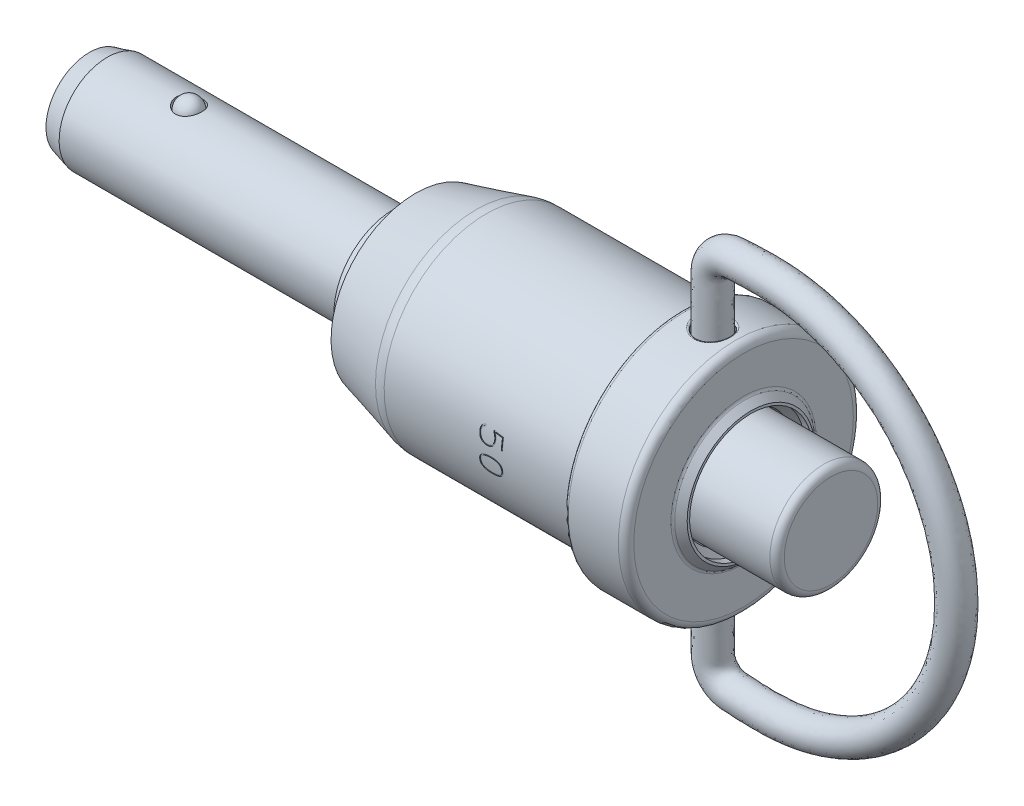
from build123d import *

# Parameters (mm, degrees)
CUT_REVOLVE_THIN1_START         = -29.083
CUT_REVOLVE_THIN1_OUTLINE_R     = 2.0828
CUT_REVOLVE_THIN1_DEPTH         = 48.895
CUT_REVOLVE_THIN1_START_2       = 3.3655
CUT_REVOLVE_THIN1_2_OUTLINE_R   = 3.556
CUT_REVOLVE_THIN1_2_OUTLINE_R_2 = 2.0828
CUT_REVOLVE_THIN1_2_DEPTH       = 16.4465
CUT_REVOLVE_THIN1_3_OUTLINE_R   = 2.159
CUT_REVOLVE_THIN1_3_DEPTH       = 48.895
CUT_REVOLVE_THIN1_START_3       = 3.2893
CUT_REVOLVE_THIN1_4_OUTLINE_R   = 3.6322
CUT_REVOLVE_THIN1_4_OUTLINE_R_2 = 2.159
CUT_REVOLVE_THIN1_4_DEPTH       = 16.5227
CHAMFER1_SIZE                   = 0.4064
FILLET1_R                       = 0.254
SKETCH7_W                       = 1.0795
SKETCH7_H                       = 2.0955
FILLET2_R                       = 0.127
FILLET2_OF_MIRROR3_R            = 0.127
SKETCH10_R                      = 1.016
FILLET3_R                       = 0.508
FILLET4_R                       = 0.47625
CUT_EXTRUDE1_START              = -6.57225
CUT_EXTRUDE1_OUTLINE_R          = 2.0828
CUT_EXTRUDE1_DEPTH              = 6.57225
FILLET5_R                       = 2.54
SKETCH13_W                      = 1.44145
SKETCH13_H                      = 2.794
FILLET6_R                       = 0.254
CUT_EXTRUDE2_REACH              = 37.166
CUT_EXTRUDE2_END_RADIUS         = 6.731


with BuildPart() as part:
    # Sketch2 → Revolve1 (revolve)
    with BuildSketch(Plane.XY):
        Polygon((14.0462, 3.556), (19.812, 3.556), (19.812, 0), (-29.083, 0), (-29.083, 2.8575), (-27.898073869, 3.175), (-9.017, 3.175), (-9.017, 5.186058546), (-3.2512, 6.731), (9.9822, 6.731), (9.9822, 7.747), (10.9982, 7.747), (13.0302, 7.747), (14.0462, 7.747), align=None)
    revolve(axis=Axis((29.083, 0, 0), (-1, 0, 0)))

    # Cut-Revolve-Thin1 3 outline → Cut-Revolve-Thin1 3 (cut)
    with BuildSketch(Plane.YZ.offset(CUT_REVOLVE_THIN1_START)):
        Circle(CUT_REVOLVE_THIN1_3_OUTLINE_R)
    extrude(amount=CUT_REVOLVE_THIN1_3_DEPTH, mode=Mode.SUBTRACT)

    # Cut-Revolve-Thin1 4 outline → Cut-Revolve-Thin1 4 (cut)
    with BuildSketch(Plane.YZ.offset(CUT_REVOLVE_THIN1_START_3)):
        Circle(CUT_REVOLVE_THIN1_4_OUTLINE_R)
        Circle(CUT_REVOLVE_THIN1_4_OUTLINE_R_2, mode=Mode.SUBTRACT)
    extrude(amount=CUT_REVOLVE_THIN1_4_DEPTH, mode=Mode.SUBTRACT)

    # Chamfer1
    chamfer1_edges = [part.edges().sort_by_distance(p)[0] for p in [
        (14.0462, -3.6322, 0),
    ]]
    chamfer(chamfer1_edges, length=CHAMFER1_SIZE)

    # Sketch4 → Revolve2 (revolve)
    with BuildSketch(Plane.XY):
        Polygon((14.0462, 4.0386), (14.5288, 4.0386), (14.5288, 4.199466667), (14.0462, 4.682066667), align=None)
    revolve(axis=Axis((29.083, 0, 0), (-1, 0, 0)))

    # Fillet1
    fillet1_edges = [part.edges().sort_by_distance(p)[0] for p in [
        (14.0462, -4.682066667, 0),
    ]]
    fillet(fillet1_edges, radius=FILLET1_R)

    # Sketch5 → Cut-Revolve1 (revolve, cut)
    with BuildSketch(Plane.XY):
        with BuildLine():
            Line((-23.4061, 2.87655), (-21.6154, 2.87655))
            ThreePointArc((-21.6154, 2.87655), (-22.51075, 3.7719), (-23.4061, 2.87655))
        make_face()
    cut_revolve1 = revolve(axis=Axis((-23.4061, 2.87655, 0), (1, 0, 0)), mode=Mode.SUBTRACT)

    # Mirror1: Cut-Revolve1 across plane
    add(cut_revolve1.mirror(Plane.ZX), mode=Mode.SUBTRACT)

    # Sketch7 → Cut-Revolve2 (revolve, cut)
    with BuildSketch(Plane.XY, mode=Mode.PRIVATE) as cut_revolve2_sk:
        with Locations((11.47445, 6.69925)):
            Rectangle(SKETCH7_W, SKETCH7_H)
    cut_revolve2 = revolve(cut_revolve2_sk.sketch.rotate(Axis((12.0142, 5.6515, 0), (0, -1, 0)), 270), axis=Axis((12.0142, 5.6515, 0), (0, -1, 0)), mode=Mode.SUBTRACT)

    # Fillet2
    fillet2_edges = [part.edges().sort_by_distance(p)[0] for p in [
        (12.0142, 7.671420256, -1.0795),
    ]]
    fillet(fillet2_edges, radius=FILLET2_R)

    # Mirror3: Cut-Revolve2 across plane
    add(cut_revolve2.mirror(Plane.ZX), mode=Mode.SUBTRACT)

    # Fillet2 of Mirror3
    fillet2_of_mirror3_edges = [part.edges().sort_by_distance(p)[0] for p in [
        (12.0142, -7.671420256, -1.0795),
    ]]
    fillet(fillet2_of_mirror3_edges, radius=FILLET2_OF_MIRROR3_R)

    # Fillet3
    fillet3_edges = [part.edges().sort_by_distance(p)[0] for p in [
        (14.0462, -7.747, 0),
        (9.9822, -6.731, 0),
    ]]
    fillet(fillet3_edges, radius=FILLET3_R)

    # Fillet5
    fillet5_edges = [part.edges().sort_by_distance(p)[0] for p in [
        (-3.2512, -6.731, 0),
    ]]
    fillet(fillet5_edges, radius=FILLET5_R)

    # Sketch13 → Cut-Revolve3 (revolve, cut)
    with BuildSketch(Plane.XY):
        with Locations((-8.296275, 5.334)):
            Rectangle(SKETCH13_W, SKETCH13_H)
    revolve(axis=Axis((29.083, 0, 0), (-1, 0, 0)), mode=Mode.SUBTRACT)

    # Fillet6
    fillet6_edges = [part.edges().sort_by_distance(p)[0] for p in [
        (9.9822, -7.747, 0),
    ]]
    fillet(fillet6_edges, radius=FILLET6_R)

    # Cut-Extrude2: up to this cylinder (the profile starts outside it)
    cut_extrude2_end = Plane(origin=(4.2243875, 0, -0.0508), z_dir=(1, 0, 0)) * Cylinder(CUT_EXTRUDE2_END_RADIUS, 90.040261, mode=Mode.PRIVATE)
    # Sketch12 → Cut-Extrude2 (cut, up to the surface)
    with BuildSketch(Plane.XY.offset(6.731), mode=Mode.PRIVATE) as cut_extrude2_sk1:
        with BuildLine():
            add(Edge.make_bspline(
                [(3.342053846, -0.776727115), (3.342591039, -0.755814817), (3.343635937, -0.715138168), (3.352473267, -0.65609105), (3.367510017, -0.60112219), (3.388459367, -0.550115095), (3.415402956, -0.503158748), (3.448328517, -0.460320393), (3.487190405, -0.421458279), (3.532303123, -0.387037424), (3.583124091, -0.35646529), (3.640090387, -0.330663218), (3.70255511, -0.308309896), (3.771023841, -0.2899541), (3.845572547, -0.276486308), (3.9258828, -0.266078417), (4.012143424, -0.26046377), (4.07156386, -0.259550966), (4.102222115, -0.25908)],
                knots=[0, 0, 0, 0, 0.961124264, 1.869489111, 2.737138021, 3.575425417, 4.397863664, 5.218748167, 6.05245426, 6.917155378, 7.821294077, 8.773389478, 9.787434677, 10.868799456, 12.028333408, 13.267910997, 14.590365739, 16, 16, 16, 16], degree=3))
            add(Edge.make_bspline(
                [(4.102222115, -0.25908), (4.133002426, -0.259553741), (4.192788559, -0.260473911), (4.279536523, -0.266069305), (4.360223611, -0.27643558), (4.435103273, -0.29006089), (4.503969514, -0.308258637), (4.566836269, -0.330571572), (4.623931916, -0.356586587), (4.675043083, -0.386897535), (4.720166668, -0.4216013), (4.759449538, -0.460169584), (4.792267009, -0.503281667), (4.819690343, -0.550005292), (4.840707768, -0.601072448), (4.855034214, -0.656189728), (4.864634085, -0.71509152), (4.865571916, -0.755805259), (4.866053846, -0.776727115)],
                knots=[0, 0, 0, 0, 1.41088183, 2.740426149, 3.981732445, 5.137689836, 6.22653356, 7.242720976, 8.191879656, 9.098030597, 9.960064561, 10.795166265, 11.613518765, 12.436223829, 13.271925543, 14.135430107, 15.041840306, 16, 16, 16, 16], degree=3))
            add(Edge.make_bspline(
                [(4.866053846, -0.776727115), (4.865572115, -0.797527109), (4.864634792, -0.837998449), (4.855035397, -0.896536076), (4.840707355, -0.951290655), (4.819686546, -1.0019945), (4.792260169, -1.048351145), (4.759437899, -1.091100874), (4.72014478, -1.129283526), (4.675047476, -1.163680714), (4.623728007, -1.193416632), (4.567020481, -1.220133232), (4.503931025, -1.241882958), (4.435007501, -1.25949857), (4.360309761, -1.274036966), (4.279477004, -1.28338907), (4.192818471, -1.28996129), (4.133008855, -1.290456079), (4.102222115, -1.290710769)],
                knots=[0, 0, 0, 0, 0.955044113, 1.858265771, 2.718595741, 3.551285256, 4.371284482, 5.187318525, 6.020650707, 6.881511265, 7.787152823, 8.741141201, 9.758097636, 10.848342068, 12.008349065, 13.252185072, 14.585574192, 16, 16, 16, 16], degree=3))
            add(Edge.make_bspline(
                [(4.102222115, -1.290710769), (4.071557372, -1.290459169), (4.012113297, -1.289971439), (3.925942513, -1.283380712), (3.845486057, -1.273987052), (3.771120276, -1.259605676), (3.702592887, -1.241833138), (3.639905891, -1.220041059), (3.583328539, -1.193538686), (3.532297363, -1.163541376), (3.48721365, -1.129426487), (3.448338809, -1.090950001), (3.415410761, -1.048474411), (3.388462361, -1.00188431), (3.367510325, -0.951240576), (3.352472332, -0.896635356), (3.343635211, -0.837951506), (3.342590841, -0.797517488), (3.342053846, -0.776727115)],
                knots=[0, 0, 0, 0, 1.413191806, 2.739494033, 3.981607085, 5.145217727, 6.227958504, 7.242764252, 8.199716263, 9.10332744, 9.966862322, 10.798774531, 11.617343641, 12.437053911, 13.272330236, 14.136818653, 15.041988974, 16, 16, 16, 16], degree=3))
        make_face()
        with BuildLine():
            add(Edge.make_bspline(
                [(4.104053846, -1.220372308), (4.132025796, -1.220007801), (4.186187106, -1.219302018), (4.264703313, -1.214258766), (4.337720297, -1.205542563), (4.405362515, -1.193450494), (4.467898509, -1.178515805), (4.524692149, -1.158839854), (4.576473779, -1.136789017), (4.622668101, -1.110597565), (4.663560719, -1.080935148), (4.699077955, -1.047766474), (4.729217609, -1.011170179), (4.75352386, -0.970721973), (4.772700039, -0.926904734), (4.786177233, -0.879594503), (4.794448818, -0.828917959), (4.795284996, -0.793978227), (4.795715385, -0.775994423)],
                knots=[0, 0, 0, 0, 1.443062877, 2.794162663, 4.05696399, 5.234675175, 6.337891502, 7.369913572, 8.33201279, 9.23769219, 10.103397884, 10.932427539, 11.738296579, 12.541081437, 13.359243711, 14.198669203, 15.072838367, 16, 16, 16, 16], degree=3))
            add(Edge.make_bspline(
                [(4.795715385, -0.775994423), (4.795282318, -0.757889249), (4.794440802, -0.722708132), (4.7862217, -0.67177747), (4.772708838, -0.624345477), (4.753437209, -0.580461528), (4.729222527, -0.539740763), (4.699193811, -0.502782797), (4.663557151, -0.46958489), (4.62258156, -0.439949083), (4.576488953, -0.413402638), (4.524854983, -0.390752824), (4.467748729, -0.371895439), (4.405441656, -0.356163792), (4.337705478, -0.344302086), (4.264707689, -0.335516092), (4.186185892, -0.330493166), (4.132025382, -0.329784471), (4.104053846, -0.329418462)],
                knots=[0, 0, 0, 0, 0.931826019, 1.810680108, 2.648641039, 3.465375851, 4.272146396, 5.081486709, 5.909069941, 6.773265223, 7.680487069, 8.643437098, 9.671641005, 10.774457854, 11.950114265, 13.210712361, 14.559454859, 16, 16, 16, 16], degree=3))
            add(Edge.make_bspline(
                [(4.104053846, -0.329418462), (4.076081809, -0.32977881), (4.022042185, -0.330474972), (3.9435275, -0.335565204), (3.870518044, -0.344261423), (3.802673451, -0.356186242), (3.740447434, -0.371801936), (3.683445375, -0.390928099), (3.63168625, -0.413287643), (3.585558377, -0.439988508), (3.544527925, -0.469436662), (3.509313955, -0.503038016), (3.478821319, -0.53959168), (3.454735328, -0.580493478), (3.435253394, -0.624269133), (3.422493865, -0.671887901), (3.413502062, -0.722656787), (3.412769232, -0.757878488), (3.412392308, -0.775994423)],
                knots=[0, 0, 0, 0, 1.440685122, 2.783282458, 4.050247727, 5.22601838, 6.328942392, 7.351285092, 8.320083027, 9.22739303, 10.091672288, 10.914758609, 11.728151126, 12.535000067, 13.351814243, 14.18813182, 15.068083433, 16, 16, 16, 16], degree=3))
            add(Edge.make_bspline(
                [(3.412392308, -0.775994423), (3.412766714, -0.793988999), (3.413494539, -0.828969477), (3.422538137, -0.879483936), (3.435261695, -0.926981274), (3.454648431, -0.970689955), (3.478827777, -1.011319324), (3.50942863, -1.047511063), (3.544524281, -1.081083696), (3.585471662, -1.110558223), (3.631702522, -1.136903161), (3.683608039, -1.158664247), (3.74029743, -1.178608604), (3.802752704, -1.193427837), (3.870503104, -1.205583606), (3.943531873, -1.214209683), (4.02204097, -1.21932021), (4.076081394, -1.220013465), (4.104053846, -1.220372308)],
                knots=[0, 0, 0, 0, 0.92724852, 1.802520701, 2.640297066, 3.458536012, 4.261396102, 5.071345166, 5.895867197, 6.761654018, 7.667418292, 8.635387132, 9.66154616, 10.764865872, 11.942687423, 13.21186266, 14.55680189, 16, 16, 16, 16], degree=3))
        make_face(mode=Mode.SUBTRACT)
    cut_extrude2_tool1 = extrude(cut_extrude2_sk1.sketch, amount=-CUT_EXTRUDE2_REACH, mode=Mode.PRIVATE) - cut_extrude2_end
    add(cut_extrude2_tool1.solids().sort_by_distance((3.601257, -0.369178, 6.731))[0], mode=Mode.SUBTRACT)
    # Sketch12 → Cut-Extrude2 (cut, up to the surface)
    with BuildSketch(Plane.XY.offset(6.731), mode=Mode.PRIVATE) as cut_extrude2_sk2:
        with BuildLine():
            Line((4.866053846, 1.166519423), (4.866053846, 0.426500192))
            Line((4.866053846, 0.426500192), (4.795715385, 0.426500192))
            Line((4.795715385, 0.426500192), (4.795715385, 1.104240577))
            Line((4.795715385, 1.104240577), (4.328257692, 1.160657885))
            add(Edge.make_bspline(
                [(4.328257692, 1.160657885), (4.338745638, 1.130886599), (4.358990651, 1.073418716), (4.380664841, 0.987669785), (4.39424592, 0.906237497), (4.396192165, 0.853218424), (4.397130769, 0.827649231)],
                knots=[0, 0, 0, 0, 1.107884654, 2.138563468, 3.102296068, 4, 4, 4, 4], degree=3))
            add(Edge.make_bspline(
                [(4.397130769, 0.827649231), (4.39668302, 0.806632495), (4.395808909, 0.76560288), (4.389759392, 0.705749497), (4.378637416, 0.649422374), (4.363543911, 0.596381038), (4.344824107, 0.546278593), (4.320708771, 0.500070658), (4.292839932, 0.456894358), (4.270797352, 0.431033905), (4.259750962, 0.418074231)],
                knots=[0, 0, 0, 0, 1.140712333, 2.22693896, 3.260335866, 4.252702962, 5.217756796, 6.157463752, 7.076633739, 8, 8, 8, 8], degree=3))
            add(Edge.make_bspline(
                [(4.259750962, 0.418074231), (4.247585008, 0.405311669), (4.223472282, 0.380016476), (4.18228753, 0.347581535), (4.137724229, 0.320521098), (4.090014323, 0.29789763), (4.038912465, 0.280314042), (3.984381732, 0.267936251), (3.926578435, 0.260559273), (3.886954605, 0.259581011), (3.866661538, 0.25908)],
                knots=[0, 0, 0, 0, 0.966694821, 1.915973669, 2.866481786, 3.82276039, 4.808250522, 5.825913262, 6.886556722, 8, 8, 8, 8], degree=3))
            add(Edge.make_bspline(
                [(3.866661538, 0.25908), (3.846372613, 0.25961531), (3.806893145, 0.260656949), (3.74943063, 0.267490351), (3.69557711, 0.27965658), (3.645091147, 0.296520218), (3.598029704, 0.318037149), (3.554585277, 0.344722294), (3.51501154, 0.376501045), (3.478652068, 0.412361452), (3.446401394, 0.452357113), (3.418626017, 0.495879994), (3.394420856, 0.542151666), (3.375706932, 0.591874526), (3.360480518, 0.644394047), (3.349501005, 0.700017875), (3.343373105, 0.758881828), (3.342499974, 0.799060332), (3.342053846, 0.819589615)],
                knots=[0, 0, 0, 0, 1.120812785, 2.180948099, 3.190693014, 4.165584866, 5.116372414, 6.043116174, 6.974439861, 7.914154569, 8.85918117, 9.806011832, 10.762430474, 11.738348724, 12.735394792, 13.780550531, 14.865968079, 16, 16, 16, 16], degree=3))
            add(Edge.make_bspline(
                [(3.342053846, 0.819589615), (3.342247126, 0.835471485), (3.342625201, 0.86653802), (3.346076138, 0.911760037), (3.351019523, 0.95447482), (3.358330884, 0.994498927), (3.367798025, 1.031983962), (3.379514735, 1.06690331), (3.393335118, 1.099283419), (3.404411953, 1.119343766), (3.409827885, 1.129152115)],
                knots=[0, 0, 0, 0, 1.18876746, 2.325348874, 3.393508322, 4.406614146, 5.368908254, 6.285338406, 7.161629585, 8, 8, 8, 8], degree=3))
            add(Edge.make_bspline(
                [(3.409827885, 1.129152115), (3.416478129, 1.139300079), (3.42983403, 1.159680563), (3.45345043, 1.188009583), (3.480461251, 1.214128042), (3.510658919, 1.238361517), (3.544003014, 1.260654612), (3.580498835, 1.280902873), (3.620162552, 1.298800149), (3.648005288, 1.308961666), (3.662240385, 1.314156923)],
                knots=[0, 0, 0, 0, 0.911004034, 1.82959894, 2.763866395, 3.7295875, 4.734686067, 5.773714567, 6.861771725, 8, 8, 8, 8], degree=3))
            Line((3.662240385, 1.314156923), (3.701805769, 1.243818462))
            add(Edge.make_bspline(
                [(3.701805769, 1.243818462), (3.688679081, 1.23883881), (3.663237641, 1.229187517), (3.627086734, 1.212642279), (3.594110568, 1.194652741), (3.564002721, 1.175729872), (3.53710045, 1.155579343), (3.51349187, 1.134178992), (3.492742063, 1.111732863), (3.474875028, 1.087753434), (3.460228911, 1.061585456), (3.447300575, 1.033558224), (3.436327507, 1.003179918), (3.427646371, 0.970293503), (3.420593124, 0.935078598), (3.416052052, 0.897227659), (3.413055454, 0.857004952), (3.412617068, 0.829364626), (3.412392308, 0.815193462)],
                knots=[0, 0, 0, 0, 1.197001869, 2.319964478, 3.387075093, 4.39819788, 5.349988337, 6.249410375, 7.111715934, 7.953144874, 8.792703038, 9.664015949, 10.583057111, 11.542959163, 12.562040515, 13.643133876, 14.791637359, 16, 16, 16, 16], degree=3))
            add(Edge.make_bspline(
                [(3.412392308, 0.815193462), (3.412676749, 0.79722184), (3.413231771, 0.762154319), (3.419515644, 0.711018087), (3.428303741, 0.662379008), (3.44162896, 0.616562074), (3.458316019, 0.573324231), (3.479571212, 0.53334217), (3.503590934, 0.495556443), (3.532000867, 0.46126581), (3.56329256, 0.429867138), (3.59846178, 0.403090905), (3.636422003, 0.380251754), (3.677379728, 0.361334228), (3.721608534, 0.34722147), (3.768713851, 0.337014663), (3.818743602, 0.330679162), (3.853087725, 0.329845677), (3.870691346, 0.329418462)],
                knots=[0, 0, 0, 0, 1.139837961, 2.224133758, 3.265254926, 4.273318023, 5.247571477, 6.20079372, 7.142288427, 8.083942587, 9.020993617, 9.949449292, 10.881101259, 11.827748605, 12.805570765, 13.820964679, 14.883101106, 16, 16, 16, 16], degree=3))
            add(Edge.make_bspline(
                [(3.870691346, 0.329418462), (3.888170595, 0.329857629), (3.922266932, 0.330714302), (3.971873594, 0.336870123), (4.018446278, 0.347648006), (4.06211812, 0.362128085), (4.102917597, 0.38104873), (4.140830967, 0.404056214), (4.17542864, 0.431875429), (4.206888319, 0.463414893), (4.235148057, 0.498266526), (4.259682652, 0.535976731), (4.280325777, 0.576452747), (4.297549354, 0.619183328), (4.310911729, 0.664690763), (4.319667179, 0.712847108), (4.325939276, 0.763497319), (4.326503881, 0.79819892), (4.326792308, 0.815926154)],
                knots=[0, 0, 0, 0, 1.113159707, 2.171412987, 3.176997705, 4.153405816, 5.096408507, 6.035457966, 6.970731525, 7.916648333, 8.867730814, 9.823381562, 10.776465354, 11.757107919, 12.753871548, 13.79111007, 14.871593592, 16, 16, 16, 16], degree=3))
            add(Edge.make_bspline(
                [(4.326792308, 0.815926154), (4.326386113, 0.827665058), (4.32554488, 0.851976443), (4.320127874, 0.889599346), (4.311243887, 0.929617326), (4.298622077, 0.971993816), (4.282799169, 1.016894004), (4.26325077, 1.064162702), (4.240108297, 1.113947138), (4.222864066, 1.147648048), (4.213957692, 1.165054038)],
                knots=[0, 0, 0, 0, 0.761137919, 1.576324095, 2.460035797, 3.417138858, 4.441353026, 5.545593538, 6.732337649, 8, 8, 8, 8], degree=3))
            Line((4.213957692, 1.165054038), (4.232641346, 1.243085769))
            Line((4.232641346, 1.243085769), (4.866053846, 1.166519423))
        make_face()
    cut_extrude2_tool2 = extrude(cut_extrude2_sk2.sketch, amount=-CUT_EXTRUDE2_REACH, mode=Mode.PRIVATE) - cut_extrude2_end
    add(cut_extrude2_tool2.solids().sort_by_distance((4.847518, 0.79651, 6.731))[0], mode=Mode.SUBTRACT)


with BuildPart() as body_2:
    # Cut-Revolve-Thin1: read off the stored shape, not the designer's step
    # Cut-Revolve-Thin1 outline → Cut-Revolve-Thin1 (new body)
    with BuildSketch(Plane.YZ.offset(CUT_REVOLVE_THIN1_START)):
        Circle(CUT_REVOLVE_THIN1_OUTLINE_R)
    extrude(amount=CUT_REVOLVE_THIN1_DEPTH)

    # Cut-Revolve-Thin1 2 outline → Cut-Revolve-Thin1 2 (add)
    with BuildSketch(Plane.YZ.offset(CUT_REVOLVE_THIN1_START_2)):
        Circle(CUT_REVOLVE_THIN1_2_OUTLINE_R)
        Circle(CUT_REVOLVE_THIN1_2_OUTLINE_R_2, mode=Mode.SUBTRACT)
    extrude(amount=CUT_REVOLVE_THIN1_2_DEPTH)

    # Fillet4
    fillet4_edges = [body_2.edges().sort_by_distance(p)[0] for p in [
        (19.812, -3.556, 0),
    ]]
    fillet(fillet4_edges, radius=FILLET4_R)

    # Cut-Extrude1: read off the stored shape, not the designer's step
    # Cut-Extrude1 outline → Cut-Extrude1 (cut)
    with BuildSketch(Plane.ZY.offset(29.083).offset(CUT_EXTRUDE1_START)):
        Circle(CUT_EXTRUDE1_OUTLINE_R)
    extrude(amount=CUT_EXTRUDE1_DEPTH, mode=Mode.SUBTRACT)


with BuildPart() as body_3:
    # Sketch6 → Revolve3 (revolve)
    with BuildSketch(Plane.XY):
        with BuildLine():
            Line((-21.717, 2.87655), (-23.3045, 2.87655))
            ThreePointArc((-23.3045, 2.87655), (-22.51075, 3.6703), (-21.717, 2.87655))
        make_face()
    revolve(axis=Axis((-21.717, 2.87655, 0), (-1, 0, 0)))


with BuildPart() as body_4:
    # Mirror2: mirrored copy
    add(body_3.part.mirror(Plane.ZX))


with BuildPart() as body_5:
    # Sweep1: sweep along a path in Sketch9
    with BuildLine(Plane.XY) as sweep1_path:
        Line((12.0142, -5.715), (12.0142, -10.855882578))
        ThreePointArc((12.0142, -10.855882578), (12.426920213, -11.898779138), (13.441540203, -12.376814162))
        ThreePointArc((13.441540203, -12.376814162), (14.530721172, -12.428699185), (15.621, -12.446))
        ThreePointArc((15.621, -12.446), (28.067, 0), (15.621, 12.446))
        ThreePointArc((15.621, 12.446), (14.530721172, 12.428699185), (13.441540203, 12.376814162))
        ThreePointArc((13.441540203, 12.376814162), (12.426920213, 11.898779138), (12.0142, 10.855882578))
        Line((12.0142, 10.855882578), (12.0142, 5.715))
    # Sketch10 → Sweep1 (sweep)
    with BuildSketch(Plane(origin=(0, 5.715, 0), x_dir=(-1, 0, 0), z_dir=(0, 1, 0))):
        with Locations((-12.0142, 0)):
            Circle(SKETCH10_R)
    sweep(path=sweep1_path.line)


solid = Compound([part.part, body_2.part, body_3.part, body_4.part, body_5.part])
